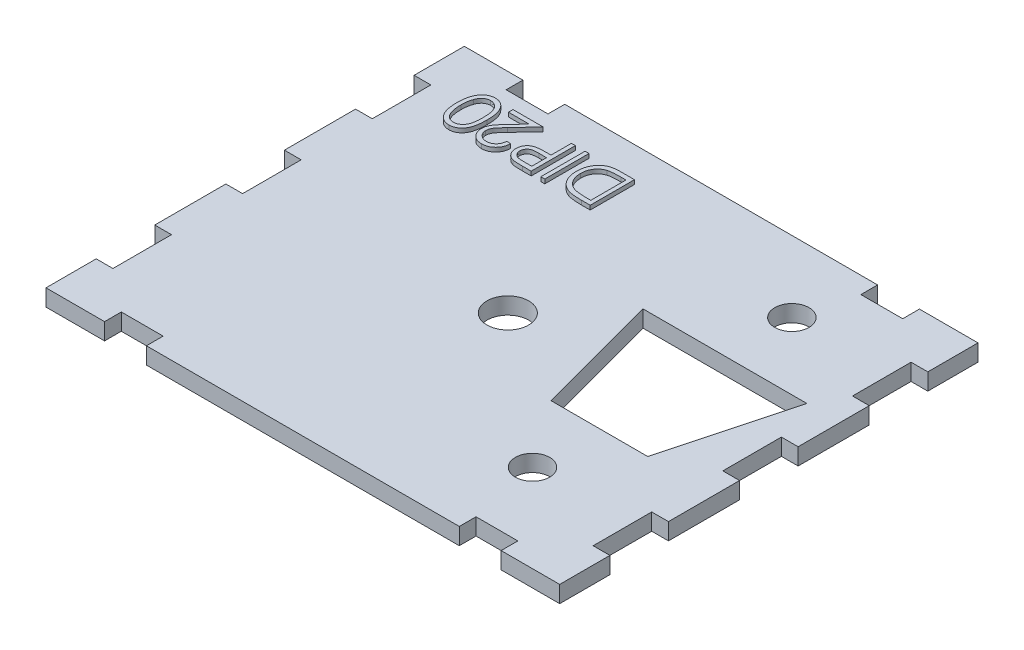
from build123d import *

# Parameters (mm, degrees)
SKETCH2_W           = 100
SKETCH2_H           = 50
BOSS_EXTRUDE1_DEPTH = 2
SKETCH12_W          = 9.8
SKETCH12_H          = 50
SKETCH12_W_2        = 8.8
CUT_EXTRUDE8_DEPTH  = 6
SKETCH13_W          = 5
SKETCH13_H          = 2
CUT_EXTRUDE10_DEPTH = 6
CUT_EXTRUDE13_DEPTH = 10
SKETCH16_R          = 2.5
CUT_EXTRUDE14_DEPTH = 10
SKETCH17_R          = 2.05
CUT_EXTRUDE15_DEPTH = 3.5
SKETCH22_W          = 0.474893162
SKETCH22_H          = 5.291666666
BOSS_EXTRUDE4_DEPTH = 0.5


with BuildPart() as part:
    # Sketch2 → Boss-Extrude1 (new body)
    with BuildSketch(Plane(origin=(0, 0, 0), x_dir=(1, 0, 0), z_dir=(0, 1, 0))):
        Rectangle(SKETCH2_W, SKETCH2_H)
    extrude(amount=BOSS_EXTRUDE1_DEPTH)

    # Sketch12 → Cut-Extrude8 (cut)
    with BuildSketch(Plane(origin=(0, 2, 0), x_dir=(1, 0, 0), z_dir=(0, 1, 0))):
        with Locations((-45.1, 0)):
            Rectangle(SKETCH12_W, SKETCH12_H)
        with Locations((45.6, 0)):
            Rectangle(SKETCH12_W_2, SKETCH12_H)
    extrude(amount=-CUT_EXTRUDE8_DEPTH, mode=Mode.SUBTRACT)

    # Sketch13 → Cut-Extrude10 (cut)
    with BuildSketch(Plane(origin=(0, 2, 0), x_dir=(1, 0, 0), z_dir=(0, 1, 0))):
        Polygon((-28.2, 12), (-28.2, 19), (-30.2, 19), (-30.2, 25), (-40.2, 25), (-40.2, -25), (-30.2, -25), (-30.2, -19), (-28.2, -19), (-28.2, -12), (-30.2, -12), (-30.2, -3.5), (-28.2, -3.5), (-28.2, 3.5), (-30.2, 3.5), (-30.2, 12), align=None)
        with Locations((-20.7, 24)):
            Rectangle(SKETCH13_W, SKETCH13_H)
        with Locations((21.7, 24)):
            Rectangle(SKETCH13_W, SKETCH13_H)
        with Locations((-20.7, -24)):
            Rectangle(SKETCH13_W, SKETCH13_H)
        Polygon((41.2, 25), (31.2, 25), (31.2, 19), (29.2, 19), (29.2, 12), (31.2, 12), (31.2, 3.5), (29.2, 3.5), (29.2, -3.5), (31.2, -3.5), (31.2, -12), (29.2, -12), (29.2, -19), (31.2, -19), (31.2, -25), (41.2, -25), align=None)
        with Locations((21.7, -24)):
            Rectangle(SKETCH13_W, SKETCH13_H)
    extrude(amount=-CUT_EXTRUDE10_DEPTH, mode=Mode.SUBTRACT)

    # Sketch15 → Cut-Extrude13 (cut)
    with BuildSketch(Plane.XZ):
        Polygon((7.666108138, -8.5), (27.239237886, -8.5), (23.22, 6.5), (11.685346024, 6.5), align=None)
    extrude(amount=-CUT_EXTRUDE13_DEPTH, mode=Mode.SUBTRACT)

    # Sketch16 → Cut-Extrude14 (cut)
    with BuildSketch(Plane(origin=(0, 0, 0), x_dir=(-1, 0, 0), z_dir=(0, -1, 0))):
        Circle(SKETCH16_R)
    extrude(amount=-CUT_EXTRUDE14_DEPTH, mode=Mode.SUBTRACT)

    # Sketch17 → Cut-Extrude15 (cut)
    with BuildSketch(Plane(origin=(0, 0, 0), x_dir=(-1, 0, 0), z_dir=(0, -1, 0))):
        with Locations((-17.452672874, -14.5)):
            Circle(SKETCH17_R)
        with Locations((-17.452672903, 16.5)):
            Circle(SKETCH17_R)
    extrude(amount=-CUT_EXTRUDE15_DEPTH, mode=Mode.SUBTRACT)

    # Sketch22 → Boss-Extrude4 (add)
    # profile 1 of 5: a face of its own
    with BuildSketch(Plane(origin=(0, 2, 0), x_dir=(1, 0, 0), z_dir=(0, 1, 0))):
        with BuildLine():
            add(Edge.make_bspline(
                [(-20.716744497, 18.218426666), (-20.717240429, 18.133612758), (-20.718203785, 17.96886052), (-20.728920802, 17.728793264), (-20.746723997, 17.503579492), (-20.771122173, 17.293208433), (-20.800812912, 17.097625749), (-20.840448286, 16.917354204), (-20.88552222, 16.751559148), (-20.937762848, 16.599700925), (-20.996706535, 16.45973023), (-21.060870631, 16.329070697), (-21.132757353, 16.207878408), (-21.208413198, 16.094367743), (-21.290485981, 15.989681037), (-21.378690291, 15.894288773), (-21.47224922, 15.806712705), (-21.571605461, 15.728392909), (-21.675812025, 15.660147655), (-21.781786347, 15.598284876), (-21.892551031, 15.549349711), (-22.005374005, 15.507504508), (-22.12116426, 15.474357453), (-22.239972236, 15.451301074), (-22.361904547, 15.436876513), (-22.444198293, 15.43549178), (-22.485933533, 15.434789513)],
                knots=[0, 0, 0, 0, 1.64625301, 3.197870201, 4.6634513, 6.030635694, 7.308242971, 8.501545196, 9.611429483, 10.641742253, 11.616230371, 12.55791849, 13.464870342, 14.34944951, 15.20427819, 16.044004467, 16.869007726, 17.689551165, 18.496129964, 19.285613293, 20.0683943, 20.843080271, 21.620342827, 22.403213977, 23.190190624, 24, 24, 24, 24], degree=3))
            add(Edge.make_bspline(
                [(-22.485933533, 15.434789513), (-22.528038535, 15.435373486), (-22.61181267, 15.436535387), (-22.73522212, 15.45288984), (-22.856481988, 15.473999006), (-22.973752523, 15.507854633), (-23.089251084, 15.548367281), (-23.200105454, 15.601823076), (-23.310229379, 15.659960405), (-23.414620076, 15.730883055), (-23.516396548, 15.809264255), (-23.611801364, 15.898246955), (-23.703273327, 15.995368549), (-23.787357576, 16.102795134), (-23.867657845, 16.21887954), (-23.941125855, 16.34459489), (-24.009289607, 16.47966258), (-24.073430397, 16.623456458), (-24.129519825, 16.77981748), (-24.179387809, 16.947770381), (-24.220263061, 17.128836057), (-24.254066175, 17.322005856), (-24.280303826, 17.528236739), (-24.299399145, 17.747110858), (-24.309489362, 17.978765144), (-24.311389212, 18.137149085), (-24.312364155, 18.218426666)],
                knots=[0, 0, 0, 0, 0.810910589, 1.61342667, 2.396193133, 3.181089899, 3.963115317, 4.752255436, 5.550715454, 6.36105385, 7.181178335, 8.024612154, 8.872680183, 9.750181803, 10.651284446, 11.591556747, 12.554036451, 13.566402641, 14.62422919, 15.753422176, 16.94128843, 18.199818041, 19.531985927, 20.947085226, 22.433341622, 24, 24, 24, 24], degree=3))
            add(Edge.make_bspline(
                [(-24.312364155, 18.218426666), (-24.311366549, 18.299348707), (-24.309418403, 18.45737495), (-24.299628784, 18.688001941), (-24.279791944, 18.905681719), (-24.255614422, 19.110729663), (-24.220755165, 19.30287774), (-24.181946396, 19.483157858), (-24.132443633, 19.64987607), (-24.077684634, 19.804896801), (-24.014436319, 19.948081555), (-23.946785923, 20.08259173), (-23.872221202, 20.207593617), (-23.793461748, 20.324413826), (-23.707785617, 20.430919093), (-23.617551542, 20.52912711), (-23.521221151, 20.618264406), (-23.41892076, 20.697571076), (-23.313543383, 20.769027981), (-23.203397989, 20.82923831), (-23.091062981, 20.88172943), (-22.975369929, 20.923926152), (-22.857056574, 20.957282826), (-22.73569685, 20.97999021), (-22.611796166, 20.995996057), (-22.528033014, 20.997212377), (-22.485933533, 20.997823701)],
                knots=[0, 0, 0, 0, 1.561431216, 3.049195289, 4.452146966, 5.778046447, 7.031138842, 8.218704273, 9.334037798, 10.384210803, 11.388620812, 12.352076869, 13.287433199, 14.19507451, 15.06813243, 15.922055533, 16.766344942, 17.596869952, 18.417486629, 19.220035357, 20.016159057, 20.807716045, 21.59340902, 22.384936649, 23.188266813, 24, 24, 24, 24], degree=3))
            add(Edge.make_bspline(
                [(-22.485933533, 20.997823701), (-22.444199748, 20.99711521), (-22.361908869, 20.995718204), (-22.239955549, 20.981383542), (-22.121319838, 20.958008536), (-22.005764569, 20.926265399), (-21.893053284, 20.885921737), (-21.784289992, 20.834606155), (-21.678038718, 20.775087836), (-21.574782726, 20.707375471), (-21.476495962, 20.629775573), (-21.382592523, 20.543964833), (-21.295530267, 20.447731815), (-21.21402349, 20.342612472), (-21.137739906, 20.228816063), (-21.066157605, 20.106695981), (-21.002188911, 19.974763601), (-20.941908745, 19.834033066), (-20.888771319, 19.681059028), (-20.842372699, 19.514695816), (-20.803254441, 19.333808679), (-20.772096202, 19.138388958), (-20.746570656, 18.928739176), (-20.728938353, 18.704525245), (-20.718209143, 18.466227411), (-20.717241621, 18.302534227), (-20.716744497, 18.218426666)],
                knots=[0, 0, 0, 0, 0.810976328, 1.599087026, 2.383086309, 3.159618043, 3.926613167, 4.707144544, 5.494386734, 6.292609454, 7.104690378, 7.92621526, 8.762510248, 9.62398222, 10.509836085, 11.424023232, 12.373226806, 13.358118208, 14.398657954, 15.5185989, 16.713620699, 17.994156382, 19.364120462, 20.818119981, 22.365111093, 24, 24, 24, 24], degree=3))
        make_face()
        with BuildLine():
            add(Edge.make_bspline(
                [(-21.191637659, 18.216306607), (-21.191822212, 18.286985905), (-21.192180392, 18.424160543), (-21.2012668, 18.623146598), (-21.213914152, 18.809052726), (-21.229825254, 18.981806364), (-21.253654372, 19.140803765), (-21.280690025, 19.286705867), (-21.313117431, 19.419242842), (-21.351674753, 19.53957213), (-21.395592975, 19.649400261), (-21.443467732, 19.751645476), (-21.495326441, 19.847551436), (-21.552358895, 19.936772111), (-21.615382206, 20.018809184), (-21.682989671, 20.094052275), (-21.755574408, 20.162195015), (-21.856031538, 20.243066641), (-21.988008519, 20.327620836), (-22.155144168, 20.40034548), (-22.326959281, 20.446343687), (-22.443609989, 20.452177047), (-22.501833973, 20.455088658)],
                knots=[0, 0, 0, 0, 1.459193451, 2.832007961, 4.111736495, 5.306635028, 6.412683014, 7.430020708, 8.369596877, 9.227877302, 10.036669781, 10.810175692, 11.557788084, 12.286326232, 12.994037279, 13.69140682, 14.37267704, 15.047194847, 16.352618509, 17.594157723, 18.799169539, 20, 20, 20, 20], degree=3))
            add(Edge.make_bspline(
                [(-22.501833973, 20.455088658), (-22.56039229, 20.452535574), (-22.677301204, 20.447438463), (-22.848999369, 20.402952882), (-23.014305724, 20.330633455), (-23.144763746, 20.248010224), (-23.243738474, 20.168821653), (-23.314678398, 20.101383625), (-23.379782473, 20.025850922), (-23.441532256, 19.944361484), (-23.498166684, 19.855351571), (-23.549666941, 19.759251103), (-23.596661992, 19.655792677), (-23.623436384, 19.583569385), (-23.63712544, 19.546643479)],
                knots=[0, 0, 0, 0, 1.353621445, 2.702441307, 4.075953605, 5.516772412, 6.261413105, 7.007624062, 7.778524365, 8.566925914, 9.372323995, 10.217594641, 11.088702136, 12, 12, 12, 12], degree=3))
            add(Edge.make_bspline(
                [(-23.63712544, 19.546643479), (-23.653078708, 19.499427087), (-23.685470683, 19.403557563), (-23.727217056, 19.254841089), (-23.760094029, 19.098808339), (-23.789671975, 18.936391793), (-23.809860524, 18.766393674), (-23.826110194, 18.589339974), (-23.83568159, 18.4050972), (-23.836868058, 18.279919059), (-23.837470993, 18.216306607)],
                knots=[0, 0, 0, 0, 0.884706709, 1.796334032, 2.740027952, 3.714592787, 4.726048262, 5.777819803, 6.87074269, 8, 8, 8, 8], degree=3))
            add(Edge.make_bspline(
                [(-23.837470993, 18.216306607), (-23.836806021, 18.152695522), (-23.835505032, 18.028243249), (-23.826957421, 17.846169461), (-23.81322212, 17.672936408), (-23.794631691, 17.50838694), (-23.769110968, 17.35281393), (-23.738463103, 17.205994778), (-23.702532053, 17.06796899), (-23.661317876, 16.938380859), (-23.614870734, 16.817695303), (-23.563558283, 16.705652528), (-23.508808846, 16.601648234), (-23.449303872, 16.506016944), (-23.385885258, 16.418200644), (-23.316275862, 16.340220811), (-23.244897219, 16.268283944), (-23.143381683, 16.187637415), (-23.01156069, 16.104759791), (-22.846399369, 16.030565501), (-22.675464524, 15.986655318), (-22.559669092, 15.980565949), (-22.501833973, 15.977524556)],
                knots=[0, 0, 0, 0, 1.313528337, 2.569860077, 3.762944266, 4.901481389, 5.988248151, 7.017139294, 7.997571128, 8.932104357, 9.823695246, 10.66607014, 11.475539426, 12.248954257, 12.990316782, 13.708962568, 14.405488541, 15.08007697, 16.381737273, 17.610043218, 18.806313575, 20, 20, 20, 20], degree=3))
            add(Edge.make_bspline(
                [(-22.501833973, 15.977524556), (-22.443295893, 15.980569547), (-22.326113091, 15.986665078), (-22.153390072, 16.030410579), (-21.987240021, 16.104232098), (-21.855696818, 16.1877399), (-21.755610415, 16.267970747), (-21.684387143, 16.336446079), (-21.617170962, 16.41098549), (-21.554449567, 16.492650604), (-21.497765085, 16.581701152), (-21.445276081, 16.676911849), (-21.397783283, 16.779005182), (-21.353699287, 16.888772612), (-21.31555108, 17.009299623), (-21.281251394, 17.141810167), (-21.254777198, 17.288661133), (-21.231270439, 17.448405185), (-21.213502001, 17.621364216), (-21.201354945, 17.807710428), (-21.192152794, 18.007390135), (-21.19181281, 18.145273012), (-21.191637659, 18.216306607)],
                knots=[0, 0, 0, 0, 1.207779899, 2.417760083, 3.652287919, 4.947299644, 5.621638849, 6.297435916, 6.984320042, 7.691843698, 8.42018894, 9.161205785, 9.934506883, 10.743085206, 11.601138371, 12.542248028, 13.566483018, 14.679455109, 15.87477181, 17.154161492, 18.533899613, 20, 20, 20, 20], degree=3))
        make_face(mode=Mode.SUBTRACT)
    # profile 2 of 5: a face of its own
    with BuildSketch(Plane(origin=(0, 2, 0), x_dir=(1, 0, 0), z_dir=(0, 1, 0))):
        with BuildLine():
            Line((-17.32465048, 17.198678402), (-16.849757317, 17.198678402))
            add(Edge.make_bspline(
                [(-16.849757317, 17.198678402), (-16.852851891, 17.135675678), (-16.858929551, 17.011940004), (-16.887403586, 16.831538016), (-16.928108647, 16.659082118), (-16.985797214, 16.496050803), (-17.057037554, 16.340496525), (-17.144256345, 16.194484864), (-17.245594226, 16.056566672), (-17.360865287, 15.929353198), (-17.485945012, 15.813064177), (-17.620083979, 15.711579967), (-17.761903493, 15.626816763), (-17.910173472, 15.555571335), (-18.066608702, 15.502157924), (-18.229713838, 15.462508642), (-18.400226098, 15.438657581), (-18.516400763, 15.436093539), (-18.575485149, 15.434789513)],
                knots=[0, 0, 0, 0, 1.100776268, 2.161895295, 3.184016182, 4.190939212, 5.176500551, 6.166955529, 7.155448256, 8.160289653, 9.16017456, 10.133824356, 11.091467644, 12.04088621, 13.000931625, 13.972173743, 14.968683325, 16, 16, 16, 16], degree=3))
            add(Edge.make_bspline(
                [(-18.575485149, 15.434789513), (-18.633513225, 15.43613687), (-18.747536322, 15.438784379), (-18.91388184, 15.461862354), (-19.072615359, 15.497227293), (-19.221937953, 15.549632562), (-19.363382093, 15.615389712), (-19.495196463, 15.697167342), (-19.620568474, 15.791096012), (-19.733345086, 15.901889483), (-19.836944009, 16.020106397), (-19.926240018, 16.146361068), (-20.003142442, 16.276912284), (-20.066084675, 16.412779842), (-20.113797686, 16.554406192), (-20.149148455, 16.700433513), (-20.169356865, 16.852547061), (-20.172441304, 16.955520649), (-20.174009454, 17.007873113)],
                knots=[0, 0, 0, 0, 1.111674182, 2.184400057, 3.212814286, 4.223731311, 5.211378316, 6.196328225, 7.191884489, 8.207283132, 9.220262353, 10.201199469, 11.166417575, 12.120932471, 13.06540007, 14.026332106, 14.996573967, 16, 16, 16, 16], degree=3))
            add(Edge.make_bspline(
                [(-20.174009454, 17.007873113), (-20.171449362, 17.081575165), (-20.166374103, 17.227685901), (-20.12296129, 17.442399313), (-20.055155392, 17.650425689), (-19.973523766, 17.817855649), (-19.891150425, 17.952755421), (-19.816994329, 18.063880067), (-19.729688646, 18.183499948), (-19.629979277, 18.312099225), (-19.516149085, 18.44799378), (-19.391155364, 18.593956229), (-19.251770107, 18.747287624), (-19.154027533, 18.85208326), (-19.10337978, 18.906385733)],
                knots=[0, 0, 0, 0, 1.184416499, 2.348048165, 3.509039915, 4.696071444, 5.333504901, 6.05069495, 6.844171097, 7.714965912, 8.667477798, 9.695072654, 10.805644396, 12, 12, 12, 12], degree=3))
            Line((-19.10337978, 18.906385733), (-17.779403084, 20.319404897))
            Line((-17.779403084, 20.319404897), (-20.241851335, 20.319404897))
            Line((-20.241851335, 20.319404897), (-20.241851335, 20.86213994))
            Line((-20.241851335, 20.86213994), (-16.646231676, 20.86213994))
            Line((-16.646231676, 20.86213994), (-18.698448557, 18.67211924))
            add(Edge.make_bspline(
                [(-18.698448557, 18.67211924), (-18.748417352, 18.619963931), (-18.84439718, 18.519784256), (-18.980093345, 18.373480687), (-19.102166364, 18.237912214), (-19.210697214, 18.112478104), (-19.305775196, 17.997889449), (-19.387096101, 17.893248245), (-19.455019352, 17.799452493), (-19.527003845, 17.689265166), (-19.595645836, 17.554573304), (-19.655975122, 17.390800765), (-19.692497651, 17.221836952), (-19.696901246, 17.107690788), (-19.699116292, 17.050274288)],
                knots=[0, 0, 0, 0, 1.329530082, 2.553755191, 3.672934919, 4.687409497, 5.60679272, 6.413407421, 7.126401618, 7.737995624, 8.834647426, 9.90044882, 10.943907757, 12, 12, 12, 12], degree=3))
            add(Edge.make_bspline(
                [(-19.699116292, 17.050274288), (-19.698164983, 17.014163899), (-19.696290137, 16.942997254), (-19.679430288, 16.838724367), (-19.654659824, 16.737751005), (-19.616480887, 16.641325632), (-19.5706103, 16.547551747), (-19.512007243, 16.459280369), (-19.445039337, 16.373502538), (-19.367359852, 16.293159506), (-19.28208221, 16.219552812), (-19.191978454, 16.154354698), (-19.096653465, 16.099866631), (-18.996504504, 16.055199774), (-18.891812005, 16.020160778), (-18.782373149, 15.995881743), (-18.668490414, 15.980637985), (-18.590727867, 15.978575488), (-18.551104473, 15.977524556)],
                knots=[0, 0, 0, 0, 0.991504627, 1.954065223, 2.895985987, 3.842598665, 4.797835564, 5.759220273, 6.74786863, 7.784730864, 8.824135544, 9.839918996, 10.835834653, 11.835434876, 12.84861661, 13.863796685, 14.911511676, 16, 16, 16, 16], degree=3))
            add(Edge.make_bspline(
                [(-18.551104473, 15.977524556), (-18.50971181, 15.978562631), (-18.428423454, 15.980601241), (-18.309330619, 15.996052214), (-18.194924754, 16.019451925), (-18.086968824, 16.056704074), (-17.983203502, 16.100302847), (-17.886275893, 16.15675559), (-17.79346318, 16.221261578), (-17.706631391, 16.296471463), (-17.627546394, 16.381372095), (-17.555602065, 16.473784933), (-17.494642922, 16.575348268), (-17.440530105, 16.683625061), (-17.399144484, 16.801590119), (-17.363762743, 16.926358466), (-17.33806196, 17.059710251), (-17.329195224, 17.151586311), (-17.32465048, 17.198678402)],
                knots=[0, 0, 0, 0, 1.031072318, 2.024855787, 2.988461151, 3.935103592, 4.865765533, 5.788564469, 6.724086513, 7.67908574, 8.64457978, 9.611397706, 10.591395687, 11.591555111, 12.622101007, 13.700900657, 14.821571223, 16, 16, 16, 16], degree=3))
        make_face()
    # profile 3 of 5: a face of its own
    with BuildSketch(Plane(origin=(0, 2, 0), x_dir=(1, 0, 0), z_dir=(0, 1, 0))):
        with BuildLine():
            Line((-12.779244497, 15.570473274), (-13.81701326, 15.570473274))
            add(Edge.make_bspline(
                [(-13.81701326, 15.570473274), (-13.888391654, 15.570551736), (-14.025155827, 15.570702073), (-14.221272637, 15.575260081), (-14.399389731, 15.581348056), (-14.559123045, 15.589787347), (-14.700964051, 15.599760763), (-14.82427092, 15.613748966), (-14.930012869, 15.628354413), (-14.993371429, 15.643203444), (-15.022266666, 15.649975477)],
                knots=[0, 0, 0, 0, 1.415646017, 2.712440637, 3.8905458, 4.950247383, 5.884950622, 6.709939814, 7.411656543, 8, 8, 8, 8], degree=3))
            add(Edge.make_bspline(
                [(-15.022266666, 15.649975477), (-15.058844752, 15.659987537), (-15.131139009, 15.679775734), (-15.235314186, 15.719404017), (-15.334412874, 15.766413516), (-15.428849594, 15.819911156), (-15.517006538, 15.882423347), (-15.601636135, 15.950342098), (-15.68096358, 16.026414205), (-15.753791054, 16.110539513), (-15.821268853, 16.199962107), (-15.877752607, 16.296962218), (-15.927629985, 16.398174872), (-15.966499879, 16.506071206), (-15.99705311, 16.619227004), (-16.019305061, 16.737936774), (-16.033606865, 16.861944432), (-16.034963926, 16.946704527), (-16.035654753, 16.989852614)],
                knots=[0, 0, 0, 0, 0.999333726, 1.975119402, 2.933498163, 3.889020618, 4.832249799, 5.779334906, 6.747801194, 7.724875447, 8.710438469, 9.696133548, 10.679360639, 11.681339199, 12.714023775, 13.766351759, 14.862936069, 16, 16, 16, 16], degree=3))
            add(Edge.make_bspline(
                [(-16.035654753, 16.989852614), (-16.035017599, 17.033361872), (-16.033770964, 17.118490673), (-16.018808723, 17.243030484), (-15.998654743, 17.362045193), (-15.967665152, 17.475270909), (-15.927077051, 17.582035229), (-15.879464067, 17.683969711), (-15.822036586, 17.779340167), (-15.75604976, 17.868492833), (-15.682644374, 17.951511391), (-15.602131003, 18.027794235), (-15.514834691, 18.096894842), (-15.421032872, 18.158968123), (-15.319811077, 18.212574641), (-15.212704488, 18.260588662), (-15.098782137, 18.300912765), (-15.019947622, 18.322124882), (-14.979865491, 18.332909839)],
                knots=[0, 0, 0, 0, 1.121902311, 2.195077645, 3.232258892, 4.234102512, 5.217864754, 6.176164875, 7.132989551, 8.084763148, 9.034132444, 9.988522005, 10.94243251, 11.903244335, 12.886203696, 13.894208494, 14.929344452, 16, 16, 16, 16], degree=3))
            add(Edge.make_bspline(
                [(-14.979865491, 18.332909839), (-14.946713072, 18.339954568), (-14.87405762, 18.355393501), (-14.754408864, 18.37274643), (-14.615031471, 18.386977728), (-14.456399664, 18.400258489), (-14.278143518, 18.407295632), (-14.080671866, 18.415558386), (-13.863316399, 18.419457128), (-13.711717737, 18.419703577), (-13.632568148, 18.419832248)],
                knots=[0, 0, 0, 0, 0.601372724, 1.317943291, 2.144091499, 3.08771165, 4.142394186, 5.309582461, 6.595334295, 8, 8, 8, 8], degree=3))
            Line((-13.632568148, 18.419832248), (-13.254137659, 18.419832248))
            Line((-13.254137659, 18.419832248), (-13.254137659, 20.86213994))
            Line((-13.254137659, 20.86213994), (-12.779244497, 20.86213994))
            Line((-12.779244497, 20.86213994), (-12.779244497, 15.570473274))
        make_face()
        with BuildLine():
            Line((-13.254137659, 16.113208316), (-13.254137659, 17.877097205))
            Line((-13.254137659, 17.877097205), (-14.180603338, 17.888757528))
            add(Edge.make_bspline(
                [(-14.180603338, 17.888757528), (-14.225840178, 17.888787356), (-14.313168964, 17.888844938), (-14.439658695, 17.88271634), (-14.556729458, 17.876049117), (-14.664554104, 17.865266634), (-14.762640492, 17.852115365), (-14.851226102, 17.834532053), (-14.931017891, 17.81659821), (-15.022929194, 17.785479811), (-15.125879494, 17.738533756), (-15.237617027, 17.66841397), (-15.333087585, 17.580080672), (-15.415005911, 17.479688961), (-15.479756752, 17.367889769), (-15.526684494, 17.248603261), (-15.555328213, 17.122282387), (-15.558928486, 17.03593638), (-15.560761591, 16.991972673)],
                knots=[0, 0, 0, 0, 1.160501667, 2.240324542, 3.248665471, 4.168823117, 5.020172044, 5.786515869, 6.485785279, 7.116517804, 8.272762037, 9.381837012, 10.485674779, 11.594342068, 12.695271952, 13.786226926, 14.872841088, 16, 16, 16, 16], degree=3))
            add(Edge.make_bspline(
                [(-15.560761591, 16.991972673), (-15.558846703, 16.949433268), (-15.555040144, 16.864870196), (-15.526921101, 16.740876728), (-15.479259773, 16.622946321), (-15.414953123, 16.512033242), (-15.334997849, 16.411908358), (-15.241426001, 16.325543685), (-15.135693414, 16.255641595), (-15.03810663, 16.209108439), (-14.950774144, 16.181820361), (-14.875283153, 16.16211975), (-14.789612426, 16.148532658), (-14.694572728, 16.135532366), (-14.590285742, 16.125038301), (-14.47608833, 16.117750887), (-14.352360878, 16.113530682), (-14.266469108, 16.113318373), (-14.221944484, 16.113208316)],
                knots=[0, 0, 0, 0, 1.12039168, 2.227199994, 3.330242575, 4.460839274, 5.593542475, 6.693949254, 7.801736126, 8.92216649, 9.528704869, 10.210659466, 10.975987387, 11.81211542, 12.738540127, 13.736887663, 14.826846554, 16, 16, 16, 16], degree=3))
            Line((-14.221944484, 16.113208316), (-13.254137659, 16.113208316))
        make_face(mode=Mode.SUBTRACT)
    # profile 4 of 5: a face of its own
    with BuildSketch(Plane(origin=(0, 2, 0), x_dir=(1, 0, 0), z_dir=(0, 1, 0))):
        with Locations((-11.38848595, 18.216306607)):
            Rectangle(SKETCH22_W, SKETCH22_H)
    # profile 5 of 5: a face of its own
    with BuildSketch(Plane(origin=(0, 2, 0), x_dir=(1, 0, 0), z_dir=(0, 1, 0))):
        with BuildLine():
            Line((-5.723688941, 20.86213994), (-5.723688941, 15.570473274))
            Line((-5.723688941, 15.570473274), (-6.792198557, 15.570473274))
            add(Edge.make_bspline(
                [(-6.792198557, 15.570473274), (-6.885134006, 15.571140574), (-7.06468481, 15.572429795), (-7.324143899, 15.580650845), (-7.563867423, 15.595047052), (-7.783719247, 15.616421321), (-7.98405258, 15.642076434), (-8.164546566, 15.674703333), (-8.325493708, 15.713074776), (-8.424477074, 15.745802175), (-8.471285095, 15.761278562)],
                knots=[0, 0, 0, 0, 1.314317071, 2.539253741, 3.67075822, 4.709970291, 5.662644612, 6.526156501, 7.303037452, 8, 8, 8, 8], degree=3))
            add(Edge.make_bspline(
                [(-8.471285095, 15.761278562), (-8.53251476, 15.78460108), (-8.653585603, 15.830717239), (-8.825874032, 15.917841975), (-8.988614406, 16.01615447), (-9.14052172, 16.127908689), (-9.281930695, 16.251676544), (-9.414620562, 16.386456655), (-9.534788012, 16.535847196), (-9.646577657, 16.695212634), (-9.7444226, 16.866003227), (-9.830703037, 17.044798063), (-9.904373432, 17.231250227), (-9.961856128, 17.426720174), (-10.009346768, 17.629330494), (-10.041211823, 17.840615192), (-10.062378498, 18.059342464), (-10.064495254, 18.207774813), (-10.065569283, 18.283088458)],
                knots=[0, 0, 0, 0, 0.984696416, 1.947063185, 2.89840987, 3.841051395, 4.778753227, 5.721858861, 6.681155121, 7.65838316, 8.646299769, 9.637283673, 10.641736726, 11.657050558, 12.698485921, 13.768600492, 14.86780186, 16, 16, 16, 16], degree=3))
            add(Edge.make_bspline(
                [(-10.065569283, 18.283088458), (-10.064617703, 18.348495109), (-10.062742514, 18.477385745), (-10.045925232, 18.667345988), (-10.02143462, 18.851656097), (-9.983691872, 19.029506784), (-9.937314458, 19.202095469), (-9.880072905, 19.368604968), (-9.812227131, 19.529148452), (-9.733545302, 19.682450768), (-9.64739191, 19.828139144), (-9.553513645, 19.963905237), (-9.455124841, 20.091245929), (-9.348637079, 20.207284453), (-9.237576061, 20.315634282), (-9.118164447, 20.411489008), (-8.994141156, 20.499298667), (-8.861780168, 20.57639663), (-8.719995512, 20.644977559), (-8.56508357, 20.702894566), (-8.397609727, 20.752736464), (-8.216464268, 20.792447078), (-8.022251331, 20.824455847), (-7.814444447, 20.845772044), (-7.59343275, 20.860227086), (-7.441668362, 20.861489941), (-7.363554393, 20.86213994)],
                knots=[0, 0, 0, 0, 1.105894396, 2.179280415, 3.222964075, 4.248423888, 5.251546139, 6.243661943, 7.223682738, 8.196462441, 9.155694589, 10.083899862, 10.986397372, 11.874737962, 12.745335529, 13.607670254, 14.461432187, 15.313100333, 16.195087267, 17.121790994, 18.106827133, 19.14775296, 20.255889161, 21.433815148, 22.679170477, 24, 24, 24, 24], degree=3))
            Line((-7.363554393, 20.86213994), (-5.723688941, 20.86213994))
        make_face()
        with BuildLine():
            Line((-6.198582104, 20.319404897), (-6.805978939, 20.319404897))
            add(Edge.make_bspline(
                [(-6.805978939, 20.319404897), (-6.893258737, 20.319029799), (-7.061129754, 20.318308348), (-7.30251744, 20.311977696), (-7.523073195, 20.301633338), (-7.722828334, 20.287156732), (-7.901670073, 20.268002993), (-8.059972171, 20.246647485), (-8.197215716, 20.220041815), (-8.280263794, 20.195925484), (-8.318640864, 20.184781166)],
                knots=[0, 0, 0, 0, 1.375205317, 2.645023457, 3.804390687, 4.853969522, 5.800190428, 6.637939096, 7.370582563, 8, 8, 8, 8], degree=3))
            add(Edge.make_bspline(
                [(-8.318640864, 20.184781166), (-8.366944772, 20.167771153), (-8.462398848, 20.134157409), (-8.599787552, 20.07281971), (-8.727986829, 20.000252482), (-8.849133895, 19.919112184), (-8.962450178, 19.828145931), (-9.067410918, 19.72706443), (-9.164845177, 19.617037922), (-9.253192938, 19.49769567), (-9.33309648, 19.370361835), (-9.402132876, 19.235178257), (-9.460329777, 19.092903538), (-9.508076465, 18.944032676), (-9.545302509, 18.788477067), (-9.571511109, 18.625846346), (-9.587752271, 18.456204737), (-9.589690878, 18.340720228), (-9.590676121, 18.282028428)],
                knots=[0, 0, 0, 0, 0.998420628, 1.972994, 2.929372424, 3.86770908, 4.81360496, 5.759023883, 6.706048443, 7.676227424, 8.651287839, 9.634325482, 10.632389399, 11.645655052, 12.680158286, 13.74837235, 14.855672678, 16, 16, 16, 16], degree=3))
            add(Edge.make_bspline(
                [(-9.590676121, 18.282028428), (-9.589899252, 18.220141275), (-9.588373087, 18.098563415), (-9.569222462, 17.920167468), (-9.541177148, 17.748614566), (-9.500836151, 17.583781197), (-9.448719061, 17.425881815), (-9.386356738, 17.274024356), (-9.31063909, 17.130163079), (-9.224918706, 16.993079534), (-9.128681877, 16.864849767), (-9.022355505, 16.746976056), (-8.907060737, 16.639238831), (-8.783328929, 16.541466557), (-8.649430104, 16.455397979), (-8.507630092, 16.378832716), (-8.355931452, 16.313778315), (-8.250379318, 16.279190191), (-8.196737486, 16.261612429)],
                knots=[0, 0, 0, 0, 1.122272916, 2.204715076, 3.251197285, 4.274229216, 5.279697671, 6.265416158, 7.248880903, 8.225321784, 9.195852973, 10.153576302, 11.101466393, 12.055578741, 13.010401466, 13.985536859, 14.976245305, 16, 16, 16, 16], degree=3))
            add(Edge.make_bspline(
                [(-8.196737486, 16.261612429), (-8.152361348, 16.249341164), (-8.058005503, 16.223249085), (-7.904033932, 16.194786915), (-7.730746742, 16.169682494), (-7.537374575, 16.148428077), (-7.324137857, 16.133177008), (-7.090872591, 16.121729901), (-6.83747795, 16.114009159), (-6.661821024, 16.113481947), (-6.570652416, 16.113208316)],
                knots=[0, 0, 0, 0, 0.674548936, 1.434276114, 2.292660221, 3.240891867, 4.284742987, 5.42552168, 6.663806718, 8, 8, 8, 8], degree=3))
            Line((-6.570652416, 16.113208316), (-6.198582104, 16.113208316))
            Line((-6.198582104, 16.113208316), (-6.198582104, 20.319404897))
        make_face(mode=Mode.SUBTRACT)
    extrude(amount=BOSS_EXTRUDE4_DEPTH)


solid = part.part
